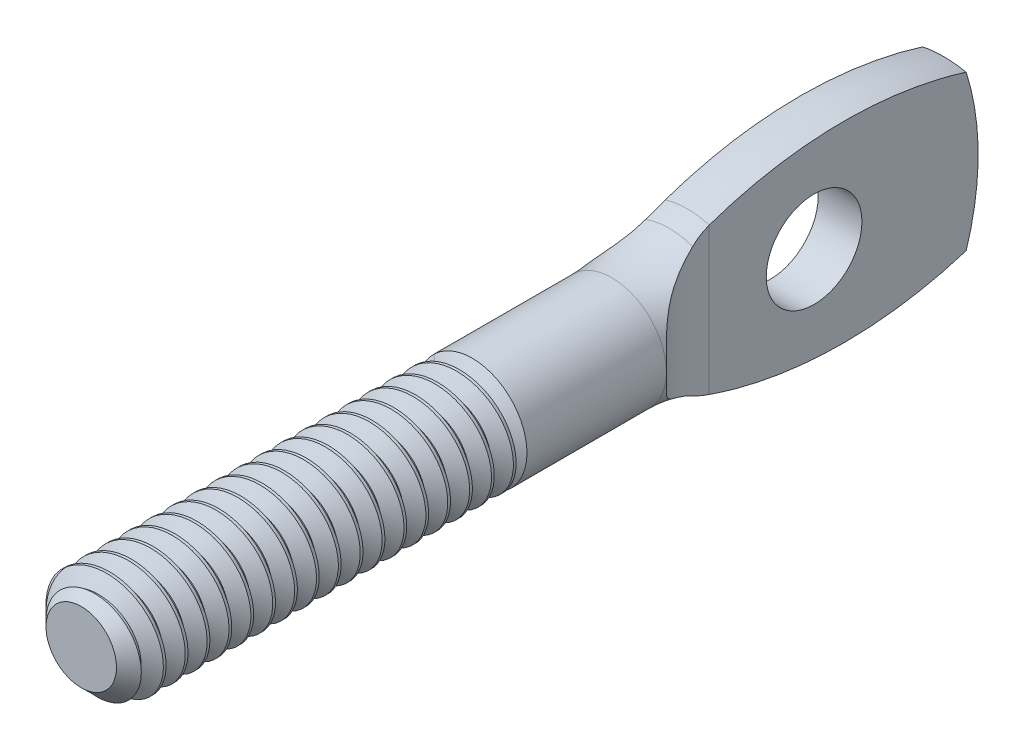
from build123d import *

# Parameters (mm, degrees)
SKETCH1_R          = 3.175
EXTRUDE1_DEPTH     = 50.8
CUT_SWEEP1_PITCH   = 1.27
SKETCH30_R         = 2.778125
CUT_EXTRUDE7_DEPTH = 12.7
CUT_EXTRUDE8_DEPTH = 12.7


with BuildPart() as part:
    # Sketch1 → Extrude1 (new body)
    with BuildSketch(Plane.XY):
        Circle(SKETCH1_R)
    extrude(amount=-EXTRUDE1_DEPTH)

    # Cut-Sweep1: arcs per turn and ends read off the stored shape
    # Cut-Sweep1: the profile of Sketch3 profile screwed along a right-hand helix through 43 turns, 6 arcs to a turn; built about Z, then put on its axis
    cut_sweep1_z = Axis((0, 0, 0), (0, 0, 1))
    cut_sweep1_corners = [(3.1753, 0, -2.381423205), (2.350110803, 0, -1.905), (2.350110803, 0, -1.74625), (3.1753, 0, -1.269826795)]
    with BuildLine(mode=Mode.PRIVATE) as cut_sweep1_profile:
        Line(cut_sweep1_corners[0], cut_sweep1_corners[1])
        Line(cut_sweep1_corners[1], cut_sweep1_corners[2])
        Line(cut_sweep1_corners[2], cut_sweep1_corners[3])
        Line(cut_sweep1_corners[3], cut_sweep1_corners[0])
    cut_sweep1_cap = Face(cut_sweep1_profile.wire())
    cut_sweep1_turn_angles = [0, 30, 60, 90, 120, 150, 180, 210, 240, 270, 300, 330, 360]
    cut_sweep1_turn_weights = [1, 0.8660254037844387, 1, 0.8660254037844387, 1, 0.8660254037844387, 1, 0.8660254037844387, 1, 0.8660254037844387, 1, 0.8660254037844387, 1]
    cut_sweep1_turn_rails = [Edge.make_bspline([Vector(p[0], p[1], 0).rotate(cut_sweep1_z, cut_sweep1_turn_angles[k]) / cut_sweep1_turn_weights[k] + Vector(0, 0, p[2] + CUT_SWEEP1_PITCH * cut_sweep1_turn_angles[k] / 360) for k in range(13)], [0, 0, 0, 1, 1, 2, 2, 3, 3, 4, 4, 5, 5, 6, 6, 6], 2, cut_sweep1_turn_weights) for p in cut_sweep1_corners]
    cut_sweep1_turn_sides = [Face.make_surface_from_curves(cut_sweep1_turn_rails[p[0]], cut_sweep1_turn_rails[p[1]]) for p in [(0, 1), (1, 2), (2, 3), (3, 0)]]
    cut_sweep1 = Plane(origin=(0, 0, 0), x_dir=(0, 1, 0), z_dir=(0, 0, -1)) * Solid(Shell([*[p.moved(Location((0, 0, CUT_SWEEP1_PITCH * i))) for i in range(43) for p in cut_sweep1_turn_sides], cut_sweep1_cap, cut_sweep1_cap.rotate(cut_sweep1_z, 15480).moved(Location((0, 0, CUT_SWEEP1_PITCH * 15480 / 360)))]))
    add(cut_sweep1, mode=Mode.SUBTRACT)

    # Sketch4 → Cut-Revolve1 (revolve, cut)
    with BuildSketch(Plane(origin=(0, 0, 0), x_dir=(0, 0, -1), z_dir=(1, 0, 0)), mode=Mode.PRIVATE) as cut_revolve1_sk:
        Polygon((1.129689197, 3.175), (0, 2.045310803), (0, 3.175), align=None)
    revolve(cut_revolve1_sk.sketch.rotate(Axis((0, 0, 0), (0, 0, -1)), 266.560187232), axis=Axis((0, 0, 0), (0, 0, -1)), mode=Mode.SUBTRACT)

    # Sketch29 → Revolve2 (revolve)
    with BuildSketch(Plane(origin=(0, 0, 0), x_dir=(0, 0, -1), z_dir=(1, 0, 0)), mode=Mode.PRIVATE) as revolve2_sk:
        with BuildLine():
            Line((22.225, 0), (22.225, 2.350110803))
            Line((22.225, 2.350110803), (22.70125, 3.175))
            Line((22.70125, 3.175), (30.7975, 3.175))
            ThreePointArc((30.7975, 3.175), (32.514089628, 3.383078764), (34.13125, 3.995262603))
            ThreePointArc((34.13125, 3.995262603), (34.650383694, 4.241262104), (35.187511627, 4.445))
            ThreePointArc((35.187511627, 4.445), (42.993755813, 5.715), (50.8, 4.445))
            Line((50.8, 4.445), (50.8, 0))
            Line((50.8, 0), (22.225, 0))
        make_face()
    revolve(revolve2_sk.sketch.rotate(Axis((0, 0, 0), (0, 0, -1)), 180), axis=Axis((0, 0, 0), (0, 0, -1)))

    # Sketch30 → Cut-Extrude7 (cut, symmetric)
    with BuildSketch(Plane(origin=(0, 0, 0), x_dir=(0, 0, -1), z_dir=(1, 0, 0))):
        with Locations(Location((41.275, 0, 0), (0, 0, 313.598332475))):
            Circle(SKETCH30_R)
        with BuildLine():
            Line((52.324, 5.715), (49.657, 5.715))
            ThreePointArc((49.657, 5.715), (50.8, 0), (49.657, -5.715))
            Line((49.657, -5.715), (52.324, -5.715))
            Line((52.324, -5.715), (52.324, 5.715))
        make_face()
    extrude(amount=CUT_EXTRUDE7_DEPTH, both=True, mode=Mode.SUBTRACT)

    # Sketch31 → Cut-Extrude8 (cut, symmetric)
    with BuildSketch(Plane(origin=(0, 0, 0), x_dir=(1, 0, 0), z_dir=(0, 1, 0))):
        with BuildLine():
            Line((1.27, 50.8), (1.27, 35.187511627))
            ThreePointArc((1.27, 35.187511627), (1.766778737, 32.794750299), (3.175, 30.7975))
            Line((3.175, 30.7975), (13.97, 30.7975))
            Line((13.97, 30.7975), (13.97, 50.8))
            Line((13.97, 50.8), (1.27, 50.8))
        make_face()
        with BuildLine():
            Line((-1.27, 50.8), (-1.27, 35.187511627))
            ThreePointArc((-1.27, 35.187511627), (-1.766778737, 32.794750299), (-3.175, 30.7975))
            Line((-3.175, 30.7975), (-13.97, 30.7975))
            Line((-13.97, 30.7975), (-13.97, 50.8))
            Line((-13.97, 50.8), (-1.27, 50.8))
        make_face()
    extrude(amount=CUT_EXTRUDE8_DEPTH, both=True, mode=Mode.SUBTRACT)


solid = part.part
